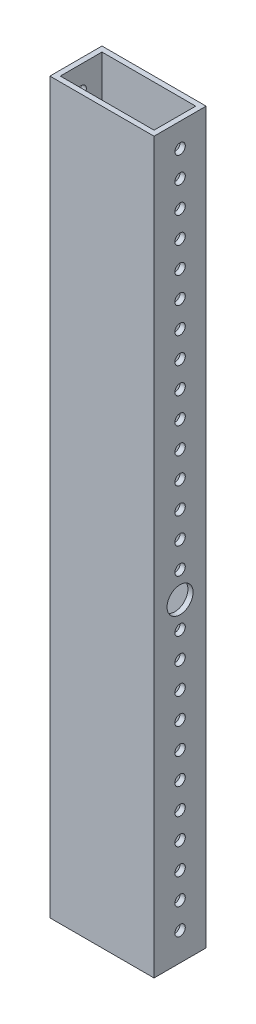
from build123d import *

# Parameters (mm, degrees)
SKETCH1_W           = 50.8
SKETCH1_H           = 25.4
SKETCH1_W_2         = 45.72
SKETCH1_H_2         = 20.32
BOSS_EXTRUDE1_DEPTH = 457.2
SKETCH3_R           = 2.54
SKETCH3_R_2         = 6.35
SKETCH3_W           = 25.4
SKETCH3_H           = 49.7403506
SKETCH3_H_2         = 51.8596494
CUT_EXTRUDE1_DEPTH  = 457.2


with BuildPart() as part:
    # Sketch1 → Boss-Extrude1 (new body)
    with BuildSketch(Plane(origin=(0, 0, 0), x_dir=(1, 0, 0), z_dir=(0, 1, 0))):
        with Locations((-21.472101782, 11.503789329)):
            Rectangle(SKETCH1_W, SKETCH1_H)
        with Locations((-21.472101782, 11.503789329)):
            Rectangle(SKETCH1_W_2, SKETCH1_H_2, mode=Mode.SUBTRACT)
    extrude(amount=BOSS_EXTRUDE1_DEPTH)

    # Sketch3 → Cut-Extrude1 (cut)
    with BuildSketch(Plane(origin=(3.927898218, 0, 0), x_dir=(0, 0, -1), z_dir=(1, 0, 0))):
        with Locations((11.503789329, 393.7)):
            Circle(SKETCH3_R)
        with Locations((11.503789329, 330.2)):
            Circle(SKETCH3_R)
        with Locations((11.503789329, 317.5)):
            Circle(SKETCH3_R)
        with Locations((11.503789329, 304.8)):
            Circle(SKETCH3_R)
        with Locations((11.503789329, 292.1)):
            Circle(SKETCH3_R)
        with Locations((11.503789329, 279.4)):
            Circle(SKETCH3_R)
        with Locations((11.503789329, 266.7)):
            Circle(SKETCH3_R)
        with Locations((11.503789329, 254)):
            Circle(SKETCH3_R)
        with Locations((11.503789329, 241.3)):
            Circle(SKETCH3_R)
        with Locations((11.503789329, 228.6)):
            Circle(SKETCH3_R)
        with Locations((11.503789329, 215.9)):
            Circle(SKETCH3_R)
        with Locations((11.503789329, 190.5)):
            Circle(SKETCH3_R)
        with Locations((11.503789329, 177.8)):
            Circle(SKETCH3_R)
        with Locations((11.503789329, 165.1)):
            Circle(SKETCH3_R)
        with Locations((11.503789329, 152.4)):
            Circle(SKETCH3_R)
        with Locations((11.503789329, 139.7)):
            Circle(SKETCH3_R)
        with Locations((11.503789329, 127)):
            Circle(SKETCH3_R)
        with Locations((11.503789329, 114.3)):
            Circle(SKETCH3_R)
        with Locations((11.503789329, 101.6)):
            Circle(SKETCH3_R)
        with Locations((11.503789329, 88.9)):
            Circle(SKETCH3_R)
        with Locations((11.503789329, 76.2)):
            Circle(SKETCH3_R)
        with Locations((11.503789329, 63.5)):
            Circle(SKETCH3_R)
        with Locations((11.503789329, 203.2)):
            Circle(SKETCH3_R_2)
        with Locations((11.503789329, 381)):
            Circle(SKETCH3_R)
        with Locations((11.503789329, 368.3)):
            Circle(SKETCH3_R)
        with Locations((11.503789329, 355.6)):
            Circle(SKETCH3_R)
        with Locations((11.503789329, 342.9)):
            Circle(SKETCH3_R)
        with Locations((11.503789329, 24.8701753)):
            Rectangle(SKETCH3_W, SKETCH3_H)
        with Locations((11.503789329, 431.2701753)):
            Rectangle(SKETCH3_W, SKETCH3_H_2)
    extrude(amount=-CUT_EXTRUDE1_DEPTH, mode=Mode.SUBTRACT)


solid = part.part
